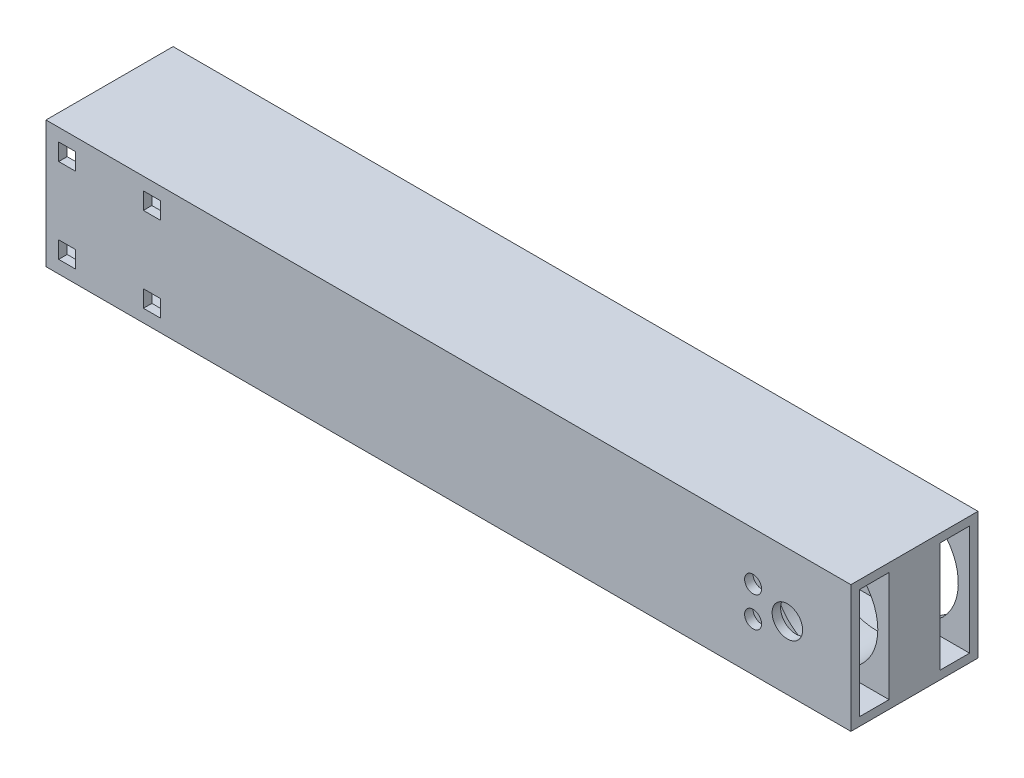
from build123d import *

# Parameters (mm, degrees)
BOSS_EXTRUDE3_DEPTH      = 110
BOSS_EXTRUDE3_DEPTH_BACK = 80
SKETCH1_W                = 30
SKETCH1_H                = 30
SKETCH1_W_2              = 7
SKETCH1_H_2              = 26
SKETCH6_R                = 12.35
CUT_EXTRUDE5_DEPTH       = 23
SKETCH8_R                = 3.6
SKETCH8_R_2              = 2
CUT_EXTRUDE6_DEPTH       = 17
SKETCH9_W                = 12
SKETCH9_H                = 26
CUT_EXTRUDE7_DEPTH       = 106
SKETCH12_W               = 4
SKETCH12_H               = 4
SKETCH12_W_2             = 4.027296216
CUT_EXTRUDE8_DEPTH       = 40


with BuildPart() as part:
    # Sketch1 → Boss-Extrude3 (new, two sides: drawn at the far end of the back side and taken through both)
    with BuildSketch(Plane(origin=(0, 0, 0), x_dir=(0, 0, -1), z_dir=(1, 0, 0)).offset(-BOSS_EXTRUDE3_DEPTH_BACK)):
        Rectangle(SKETCH1_W, SKETCH1_H)
        with Locations((-9.5, 0)):
            Rectangle(SKETCH1_W_2, SKETCH1_H_2, mode=Mode.SUBTRACT)
        with Locations((9.5, 0)):
            Rectangle(SKETCH1_W_2, SKETCH1_H_2, mode=Mode.SUBTRACT)
    extrude(amount=BOSS_EXTRUDE3_DEPTH + BOSS_EXTRUDE3_DEPTH_BACK)

    # Sketch6 → Cut-Extrude5 (cut)
    with BuildSketch(Plane(origin=(0, 0, -15), x_dir=(-1, 0, 0), z_dir=(0, 0, -1))):
        with Locations((-95, 0)):
            Circle(SKETCH6_R)
    extrude(amount=-CUT_EXTRUDE5_DEPTH, mode=Mode.SUBTRACT)

    # Sketch8 → Cut-Extrude6 (cut)
    with BuildSketch(Plane.XY.offset(15)):
        with Locations((95, 0)):
            Circle(SKETCH8_R)
        with Locations((86.906938117, 3.581179883)):
            Circle(SKETCH8_R_2)
        with Locations((86.906938117, -3.581179883)):
            Circle(SKETCH8_R_2)
    extrude(amount=-CUT_EXTRUDE6_DEPTH, mode=Mode.SUBTRACT)

    # Sketch9 → Cut-Extrude7 (cut)
    with BuildSketch(Plane.ZY.offset(80)):
        Rectangle(SKETCH9_W, SKETCH9_H)
    extrude(amount=-CUT_EXTRUDE7_DEPTH, mode=Mode.SUBTRACT)

    # Sketch12 → Cut-Extrude8 (cut)
    with BuildSketch(Plane.XY.offset(15)):
        with Locations((-75, 10)):
            Rectangle(SKETCH12_W, SKETCH12_H)
        with Locations((-55, 10)):
            Rectangle(SKETCH12_W_2, SKETCH12_H)
        with Locations((-55, -10)):
            Rectangle(SKETCH12_W, SKETCH12_H)
        with Locations((-75, -10)):
            Rectangle(SKETCH12_W, SKETCH12_H)
    extrude(amount=-CUT_EXTRUDE8_DEPTH, mode=Mode.SUBTRACT)


solid = part.part
